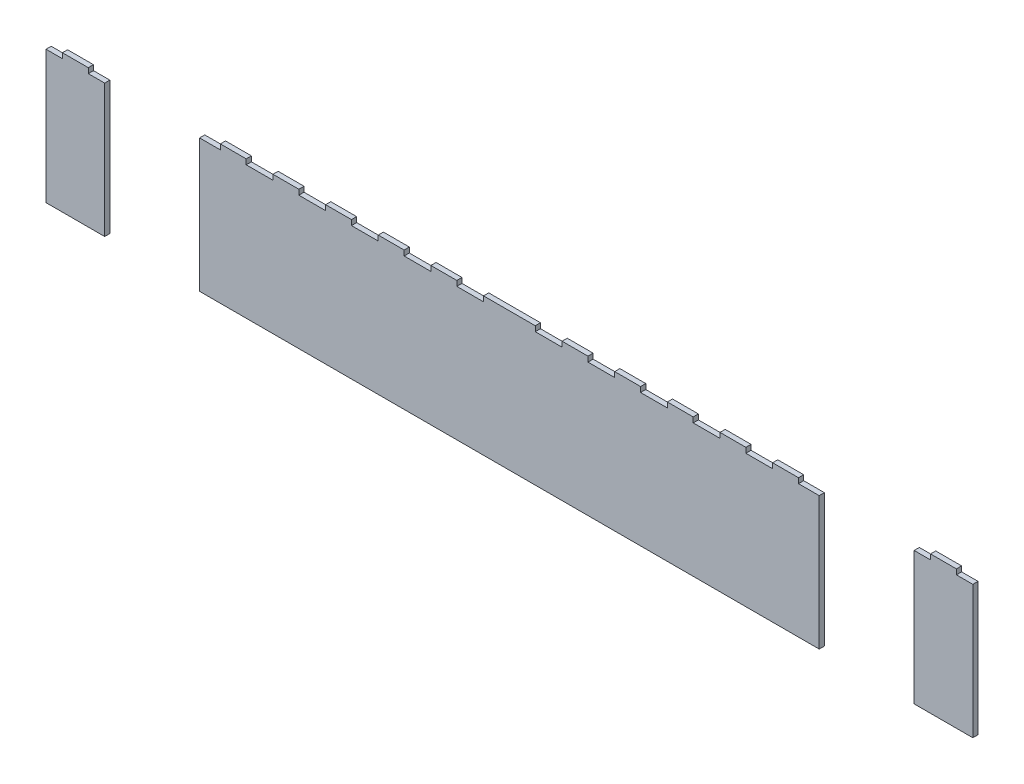
from build123d import *

# Parameters (mm, degrees)
SKETCH1_W             = 34
SKETCH1_H             = 80
BOSS_EXTRUDE1_DEPTH   = 3
SKETCH1_W_2           = 359
BOSS_EXTRUDE1_2_DEPTH = 3
BOSS_EXTRUDE1_3_DEPTH = 3
CAVITY1_START         = 37
CAVITY1_OUTLINE_W     = 9.5
CAVITY1_OUTLINE_H     = 3
CAVITY1_OUTLINE_W_2   = 12
CAVITY1_OUTLINE_W_3   = 15.5
CAVITY1_DEPTH         = 3


# Read off the part's stored shape, not the designer's step: Cavity1
with BuildPart() as part:
    # Sketch1 → Boss-Extrude1 (new body)
    with BuildSketch(Plane.XY):
        with Locations((-251.5, 0)):
            Rectangle(SKETCH1_W, SKETCH1_H)
    extrude(amount=BOSS_EXTRUDE1_DEPTH)


with BuildPart() as body_2:
    # Sketch1 → Boss-Extrude1 2 (new body)
    with BuildSketch(Plane.XY):
        Rectangle(SKETCH1_W_2, SKETCH1_H)
    extrude(amount=BOSS_EXTRUDE1_2_DEPTH)


with BuildPart() as body_3:
    # Sketch1 → Boss-Extrude1 3 (new body)
    with BuildSketch(Plane.XY):
        with Locations((251.5, 0)):
            Rectangle(SKETCH1_W, SKETCH1_H)
    extrude(amount=BOSS_EXTRUDE1_3_DEPTH)


with BuildPart() as cavity1_tool:
    # Cavity1 outline → Cavity1 (new body)
    with BuildSketch(Plane(origin=(0, 0, 0), x_dir=(1, 0, 0), z_dir=(0, 1, 0)).offset(CAVITY1_START)):
        with Locations((239.25, -1.5)):
            Rectangle(CAVITY1_OUTLINE_W, CAVITY1_OUTLINE_H)
        with Locations((263.75, -1.5)):
            Rectangle(CAVITY1_OUTLINE_W, CAVITY1_OUTLINE_H)
        with Locations((-173.5, -1.5)):
            Rectangle(CAVITY1_OUTLINE_W_2, CAVITY1_OUTLINE_H)
        with Locations((-144.75, -1.5)):
            Rectangle(CAVITY1_OUTLINE_W_3, CAVITY1_OUTLINE_H)
        with Locations((-114.25, -1.5)):
            Rectangle(CAVITY1_OUTLINE_W_3, CAVITY1_OUTLINE_H)
        with Locations((-83.75, -1.5)):
            Rectangle(CAVITY1_OUTLINE_W_3, CAVITY1_OUTLINE_H)
        with Locations((-53.25, -1.5)):
            Rectangle(CAVITY1_OUTLINE_W_3, CAVITY1_OUTLINE_H)
        with Locations((-22.75, -1.5)):
            Rectangle(CAVITY1_OUTLINE_W_3, CAVITY1_OUTLINE_H)
        with Locations((22.75, -1.5)):
            Rectangle(CAVITY1_OUTLINE_W_3, CAVITY1_OUTLINE_H)
        with Locations((53.25, -1.5)):
            Rectangle(CAVITY1_OUTLINE_W_3, CAVITY1_OUTLINE_H)
        with Locations((83.75, -1.5)):
            Rectangle(CAVITY1_OUTLINE_W_3, CAVITY1_OUTLINE_H)
        with Locations((114.25, -1.5)):
            Rectangle(CAVITY1_OUTLINE_W_3, CAVITY1_OUTLINE_H)
        with Locations((144.75, -1.5)):
            Rectangle(CAVITY1_OUTLINE_W_3, CAVITY1_OUTLINE_H)
        with Locations((173.5, -1.5)):
            Rectangle(CAVITY1_OUTLINE_W_2, CAVITY1_OUTLINE_H)
        with Locations((-263.75, -1.5)):
            Rectangle(CAVITY1_OUTLINE_W, CAVITY1_OUTLINE_H)
        with Locations((-239.25, -1.5)):
            Rectangle(CAVITY1_OUTLINE_W, CAVITY1_OUTLINE_H)
    extrude(amount=CAVITY1_DEPTH)


with BuildPart() as part_1:
    add(part.part)

    # Cavity1: cut by cavity1_tool
    add(cavity1_tool.part, mode=Mode.SUBTRACT)


with BuildPart() as body_2_1:
    add(body_2.part)

    # Cavity1: cut by cavity1_tool
    add(cavity1_tool.part, mode=Mode.SUBTRACT)


with BuildPart() as body_3_1:
    add(body_3.part)

    # Cavity1: cut by cavity1_tool
    add(cavity1_tool.part, mode=Mode.SUBTRACT)


solid = Compound([part_1.part, body_2_1.part, body_3_1.part])
